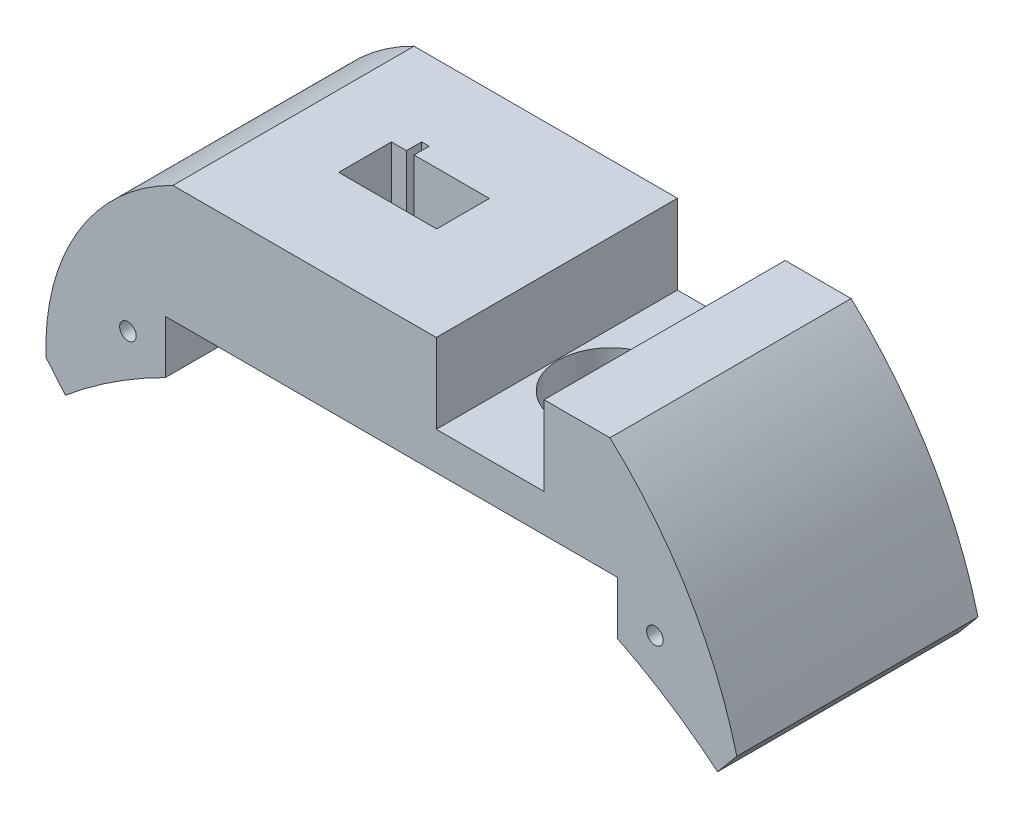
from build123d import *

# Parameters (mm, degrees)
DODANIE_WYCI_GNI_CIE1_DEPTH = 32
SZKIC3_R                    = 7
WYTNIJ_WYCI_GNI_CIE1_DEPTH  = 2346.89822878
SZKIC4_W                    = 14.3
SZKIC4_H                    = 32
WYTNIJ_WYCI_GNI_CIE2_DEPTH  = 10.55
WYTNIJ_WYCI_GNI_CIE3_DEPTH  = 2346.89822878
SZKIC5_R                    = 1.1
WYTNIJ_WYCI_GNI_CIE4_DEPTH  = 2466.118698968


with BuildPart() as part:
    # Szkic2 → Dodanie-wyciągnięcie1 (new body)
    with BuildSketch(Plane.XY):
        with BuildLine():
            Line((2256.521957604, 726.254671213), (2253.956059649, 729.323248683))
            ThreePointArc((2253.956059649, 729.323248683), (2258.199533374, 745.909111663), (2270.791718302, 757.508025354))
            Line((2270.791718302, 757.508025354), (2328.791718302, 757.508025354))
            ThreePointArc((2328.791718302, 757.508025354), (2339.252846693, 744.636164183), (2345.627376956, 729.323248683))
            Line((2345.627376956, 729.323248683), (2343.061479001, 726.254671213))
            ThreePointArc((2343.061479001, 726.254671213), (2336.68209779, 730.98003125), (2329.791718302, 734.923152173))
            Line((2329.791718302, 734.923152173), (2329.791718302, 741.961620874))
            Line((2329.791718302, 741.961620874), (2299.791718302, 741.961620874))
            Line((2299.791718302, 741.961620874), (2269.791718302, 741.961620874))
            Line((2269.791718302, 741.961620874), (2269.791718302, 734.923152173))
            ThreePointArc((2269.791718302, 734.923152173), (2262.901338815, 730.98003125), (2256.521957604, 726.254671213))
        make_face()
    extrude(amount=DODANIE_WYCI_GNI_CIE1_DEPTH)

    # Szkic3 → Wytnij-wyciągnięcie1 (cut, through all)
    with BuildSketch(Plane.XZ.offset(-741.961620874)):
        with Locations((2312.891718302, 16)):
            Circle(SZKIC3_R)
    extrude(amount=-WYTNIJ_WYCI_GNI_CIE1_DEPTH, mode=Mode.SUBTRACT)

    # Szkic4 → Wytnij-wyciągnięcie2 (cut)
    with BuildSketch(Plane(origin=(0, 757.508025354, 0), x_dir=(1, 0, 0), z_dir=(0, 1, 0))):
        with Locations((2312.891718302, -16)):
            Rectangle(SZKIC4_W, SZKIC4_H)
    extrude(amount=-WYTNIJ_WYCI_GNI_CIE2_DEPTH, mode=Mode.SUBTRACT)

    # Szkic7 → Wytnij-wyciągnięcie3 (cut, through all)
    with BuildSketch(Plane.XZ.offset(-741.961620874)):
        Polygon((2280.291718302, 19.5), (2293.291718302, 19.5), (2293.291718302, 12.5), (2283.291718302, 12.5), (2283.291718302, 10.5), (2282.291718302, 10.5), (2282.291718302, 12.5), (2280.291718302, 12.5), align=None)
    extrude(amount=-WYTNIJ_WYCI_GNI_CIE3_DEPTH, mode=Mode.SUBTRACT)

    # Szkic5 → Wytnij-wyciągnięcie4 (cut, through all)
    with BuildSketch(Plane(origin=(0, 0, 0), x_dir=(-1, 0, 0), z_dir=(0, 0, -1))):
        with Locations((-2264.822745556, 737.761269348)):
            Circle(SZKIC5_R)
        with Locations((-2334.760691049, 737.761269348)):
            Circle(SZKIC5_R)
    extrude(amount=-WYTNIJ_WYCI_GNI_CIE4_DEPTH, mode=Mode.SUBTRACT)


solid = part.part
